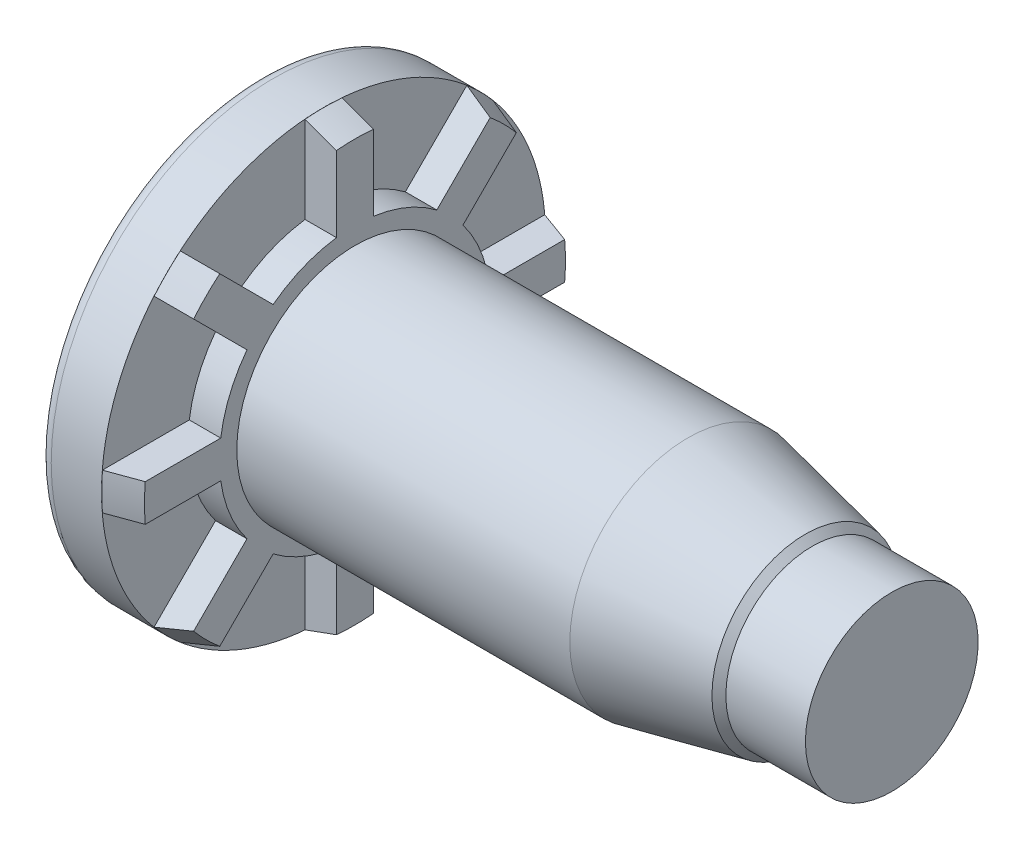
from build123d import *

# Parameters (mm, degrees)
RIBCUT_START     = -1.0541
RIBCUT_DEPTH     = 1.0541
RIBCUTSPAT_COUNT = 8
RIBCUTSPAT_ANGLE = 315


with BuildPart() as part:
    # BodySke → BaseBody (revolve)
    with BuildSketch(Plane.XY):
        with BuildLine():
            Line((-2.1082, 7.02056), (-2.1082, 0))
            Line((-2.1082, 0), (19.05, 0))
            Line((19.05, 0), (19.05, 2.8956))
            Line((19.05, 2.8956), (16.383, 2.8956))
            Line((16.383, 2.8956), (16.14932, 3.12928))
            Line((16.14932, 3.12928), (12.2174, 3.9624))
            Line((12.2174, 3.9624), (1.0541, 3.9624))
            Line((1.0541, 3.9624), (1.0541, 7.05692346))
            Line((1.0541, 7.05692346), (0.00254, 7.43966))
            Line((0.00254, 7.43966), (0, 7.43966))
            Line((0, 7.43966), (0, 7.4422))
            Line((0, 7.4422), (-1.68656, 7.4422))
            ThreePointArc((-1.68656, 7.4422), (-1.984704503, 7.318704503), (-2.1082, 7.02056))
        make_face()
    revolve(axis=Axis((0, 0, 0), (1, 0, 0)))

    # RibCutSke → RibCut (cut)
    with BuildSketch(Plane(origin=(1.0541, 1.794401132, -0.090952894), x_dir=(0, 0, -1), z_dir=(1, 0, 0)).offset(RIBCUT_START)):
        with BuildLine():
            Line((0.52890303, 2.705473707), (0.52890303, 5.621940248))
            ThreePointArc((0.52890303, 5.621940248), (2.757053746, 5.081295124), (4.71488806, 3.888048477))
            Line((4.71488806, 3.888048477), (2.652634792, 1.825795208))
            ThreePointArc((2.652634792, 1.825795208), (1.647335573, 2.40219846), (0.52890303, 2.705473707))
        make_face()
    ribcut = extrude(amount=RIBCUT_DEPTH, mode=Mode.SUBTRACT)

    # RibCutsPat: RibCut ×8 about axis
    ribcutspat_axis = Axis((0, 0, 0), (1, 0, 0))
    for i in range(1, RIBCUTSPAT_COUNT):
        add(ribcut.rotate(ribcutspat_axis, i * RIBCUTSPAT_ANGLE / (RIBCUTSPAT_COUNT - 1)), mode=Mode.SUBTRACT)


solid = part.part
